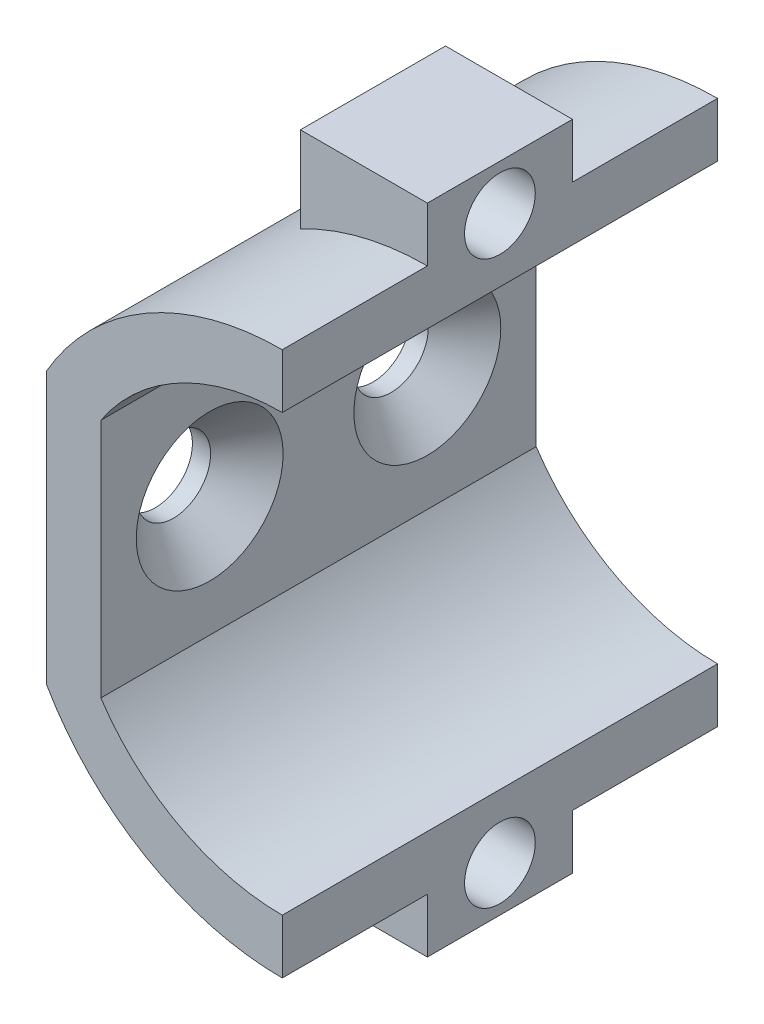
from build123d import *

# Parameters (mm, degrees)
BOSS_EXTRUDE2_DEPTH  = 12
BOSS_EXTRUDE3_START  = -12
BOSS_EXTRUDE3_DEPTH  = 12
CUT_EXTRUDE6_START   = -4
CUT_EXTRUDE6_DEPTH   = 4
CUT_EXTRUDE7_REACH   = 18.348
SKETCH4_R            = 0.975
MIRROR2_START        = -4
MIRROR2_COPY_1_DEPTH = 4
CUT_EXTRUDE8_REACH   = 17.812
SKETCH6_R            = 1.025
CHAMFER1_SIZE        = 1


# Read off the part's stored shape, not the designer's step: Boss-Extrude3
with BuildPart() as part:
    # Sketch1 → Boss-Extrude2 (new body)
    with BuildSketch(Plane.XY):
        with BuildLine():
            Line((0, 6), (0, 7.5))
            ThreePointArc((0, 7.5), (-3.75510396, 6.492241081), (-6.501077384, 3.739785134))
            Line((-6.501077384, 3.739785134), (-6.501077384, -3.739785134))
            ThreePointArc((-6.501077384, -3.739785134), (-3.75510396, -6.492241081), (0, -7.5))
            Line((0, -7.5), (0, -6))
            ThreePointArc((0, -6), (-2.838133189, -5.286303056), (-5.001077384, -3.315))
            ThreePointArc((-5.001077384, -3.315), (-6, 0), (-5.001077384, 3.315))
            ThreePointArc((-5.001077384, 3.315), (-2.838133189, 5.286303056), (0, 6))
        make_face()
        with BuildLine():
            Line((-5.001077384, -3.315), (-5.001077384, 3.315))
            ThreePointArc((-5.001077384, 3.315), (-6, 0), (-5.001077384, -3.315))
        make_face()
    extrude(amount=BOSS_EXTRUDE2_DEPTH)

    # Boss-Extrude3 outline → Boss-Extrude3 (add)
    with BuildSketch(Plane.XY.offset(12).offset(BOSS_EXTRUDE3_START)):
        with BuildLine():
            ThreePointArc((-3.5, 6.633249581), (-1.802862744, 7.280088319), (0, 7.5))
            Line((0, 7.5), (0, 9))
            Line((0, 9), (-3.5, 9))
            Line((-3.5, 9), (-3.5, 6.633249581))
        make_face()
    boss_extrude3 = extrude(amount=BOSS_EXTRUDE3_DEPTH)

    # Sketch3 → Cut-Extrude6 (cut)
    with BuildSketch(Plane.XY.offset(12).offset(CUT_EXTRUDE6_START)):
        with BuildLine():
            Line((-4.617876388, 10.846765639), (-4.617876388, 5.909756142))
            ThreePointArc((-4.617876388, 5.909756142), (-1.858071818, 7.266193578), (1.214101671, 7.401078106))
            Line((1.214101671, 7.401078106), (1.214101671, 10.846765639))
            Line((1.214101671, 10.846765639), (-4.617876388, 10.846765639))
        make_face()
    cut_extrude6 = extrude(amount=CUT_EXTRUDE6_DEPTH, mode=Mode.SUBTRACT)

    # Mirror1: Cut-Extrude6 across plane
    add(cut_extrude6.mirror(Plane.XY.offset(6)), mode=Mode.SUBTRACT)

    # Sketch4 → Cut-Extrude7 (cut, up to next)
    with BuildSketch(Plane(origin=(0, 0, 0), x_dir=(0, 0, -1), z_dir=(1, 0, 0)), mode=Mode.PRIVATE) as cut_extrude7_sk1:
        with Locations((-6, 7.75)):
            Circle(SKETCH4_R)
    cut_extrude7_tool1 = extrude(cut_extrude7_sk1.sketch, amount=-CUT_EXTRUDE7_REACH, mode=Mode.PRIVATE) & part.part
    cut_extrude7 = cut_extrude7_tool1.solids().sort_by_distance((0, 7.75, 6))[0]
    add(cut_extrude7, mode=Mode.SUBTRACT)

    # Mirror2: Boss-Extrude3, Cut-Extrude6, Cut-Extrude7 across plane
    add(boss_extrude3.mirror(Plane.ZX))
    add(cut_extrude6.mirror(Plane.ZX), mode=Mode.SUBTRACT)
    add(cut_extrude7.mirror(Plane.ZX), mode=Mode.SUBTRACT)

    # Mirror2 copy 1 sketch → Mirror2 copy 1 (cut)
    with BuildSketch(Plane(origin=(0, 0, 0), x_dir=(1, 0, 0), z_dir=(0, 0, -1)).offset(MIRROR2_START)):
        with BuildLine():
            Line((-4.617876388, 10.846765639), (-4.617876388, 5.909756142))
            ThreePointArc((-4.617876388, 5.909756142), (-1.858071818, 7.266193578), (1.214101671, 7.401078106))
            Line((1.214101671, 7.401078106), (1.214101671, 10.846765639))
            Line((1.214101671, 10.846765639), (-4.617876388, 10.846765639))
        make_face()
    extrude(amount=MIRROR2_COPY_1_DEPTH, mode=Mode.SUBTRACT)

    # Sketch6 → Cut-Extrude8 (cut, up to next)
    with BuildSketch(Plane(origin=(-5.001077384, 0, 0), x_dir=(0, 0, -1), z_dir=(1, 0, 0)), mode=Mode.PRIVATE) as cut_extrude8_sk1:
        with Locations((-9, 0)):
            Circle(SKETCH6_R)
    cut_extrude8_tool1 = extrude(cut_extrude8_sk1.sketch, amount=-CUT_EXTRUDE8_REACH, mode=Mode.PRIVATE) & part.part
    # Sketch6 → Cut-Extrude8 (cut, up to next)
    with BuildSketch(Plane(origin=(-5.001077384, 0, 0), x_dir=(0, 0, -1), z_dir=(1, 0, 0)), mode=Mode.PRIVATE) as cut_extrude8_sk2:
        with Locations((-3, 0)):
            Circle(SKETCH6_R)
    cut_extrude8_tool2 = extrude(cut_extrude8_sk2.sketch, amount=-CUT_EXTRUDE8_REACH, mode=Mode.PRIVATE) & part.part
    add(cut_extrude8_tool1.solids().sort_by_distance((-5.001077, 0, 9))[0], mode=Mode.SUBTRACT)
    add(cut_extrude8_tool2.solids().sort_by_distance((-5.001077, 0, 3))[0], mode=Mode.SUBTRACT)

    # Chamfer1
    chamfer1_edges = [part.edges().sort_by_distance(p)[0] for p in [
        (-5.001077384, 0, 10.025),
        (-5.001077384, 0, 4.025),
    ]]
    chamfer(chamfer1_edges, length=CHAMFER1_SIZE)


solid = part.part
